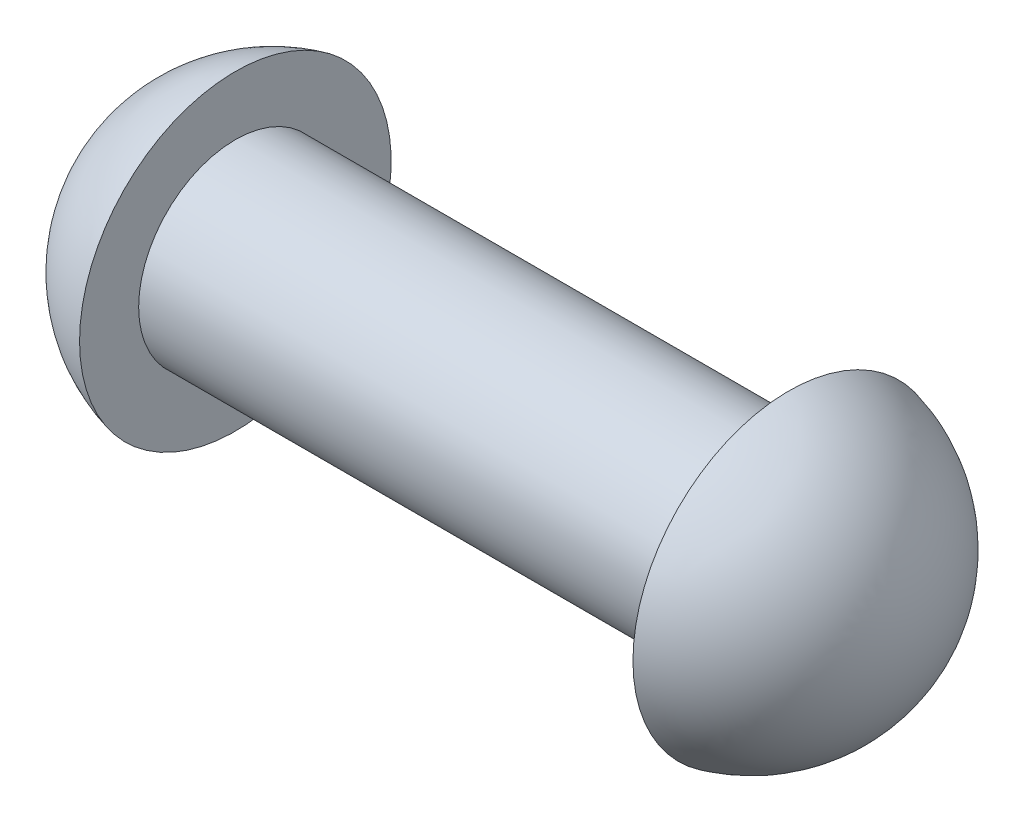
from build123d import *


with BuildPart() as part:
    # Sketch1 → Base-Revolve (revolve)
    with BuildSketch(Plane.XY):
        with BuildLine():
            Line((-126, 0), (0, 0))
            Line((0, 0), (0, 18))
            Line((0, 18), (-103, 18))
            Line((-103, 18), (-103, 29))
            ThreePointArc((-103, 29), (-119.505423573, 18.469818696), (-126, 0))
        make_face()
    revolve(axis=Axis((-138, 0, 0), (1, 0, 0)))

    # Sketch2 → HeadTypeA (revolve)
    with BuildSketch(Plane.XY):
        with BuildLine():
            Line((0, 0), (23, 0))
            ThreePointArc((23, 0), (16.505423573, 18.469818696), (0, 29))
            Line((0, 29), (0, 0))
        make_face()
    revolve(axis=Axis((-49, 0, 0), (1, 0, 0)))


solid = part.part
